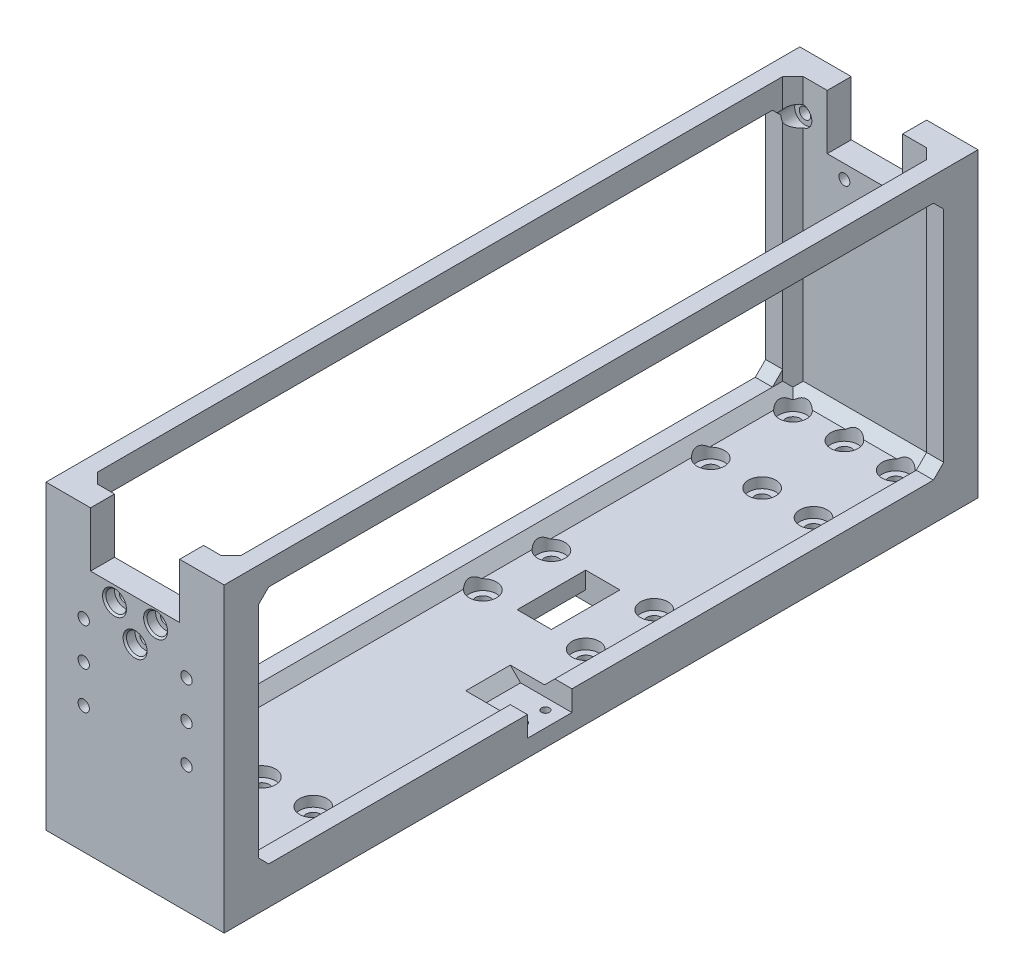
from build123d import *

# Parameters (mm, degrees)
SKETCH1_W            = 52
SKETCH1_H            = 220
BOSS_EXTRUDE1_DEPTH  = 8
SKETCH2_W            = 5
SKETCH2_H            = 220
BOSS_EXTRUDE2_DEPTH  = 80
SKETCH3_W            = 47
SKETCH3_H            = 7
BOSS_EXTRUDE3_DEPTH  = 80
SKETCH4_W            = 47
SKETCH4_H            = 7
BOSS_EXTRUDE4_DEPTH  = 80
SKETCH8_W            = 200
SKETCH8_H            = 80
CUT_EXTRUDE3_DEPTH   = 10
SKETCH12_W           = 5
SKETCH12_H           = 206
SKETCH12_H_2         = 200
BOSS_EXTRUDE6_DEPTH  = 3
SKETCH13_W           = 5
SKETCH13_H           = 3
BOSS_EXTRUDE7_DEPTH  = 77
SKETCH19_W           = 5
SKETCH19_H           = 7
BOSS_EXTRUDE11_DEPTH = 200
SKETCH21_R           = 1.65
CUT_EXTRUDE10_DEPTH  = 10
SKETCH22_R           = 3
CUT_EXTRUDE11_DEPTH  = 2
SKETCH23_R           = 1.65
CUT_EXTRUDE12_DEPTH  = 10
SKETCH24_R           = 3
CUT_EXTRUDE13_DEPTH  = 2
SKETCH25_W           = 26
SKETCH25_H           = 7
CUT_EXTRUDE14_DEPTH  = 16
SKETCH26_W           = 22
SKETCH26_H           = 7
CUT_EXTRUDE15_DEPTH  = 16
SKETCH32_R           = 1.65
CUT_EXTRUDE18_DEPTH  = 10
SKETCH33_R           = 3
CUT_EXTRUDE19_DEPTH  = 4
CHAMFER5_SIZE        = 3
CHAMFER12_SIZE       = 3
CHAMFER16_SIZE       = 3
CHAMFER18_SIZE       = 3
CHAMFER21_SIZE       = 3
SKETCH53_R           = 2.15
CUT_EXTRUDE31_DEPTH  = 11
SKETCH54_R           = 2.15
CUT_EXTRUDE32_DEPTH  = 11
SKETCH55_R           = 4
CUT_EXTRUDE33_DEPTH  = 6
SKETCH56_R           = 2.15
CUT_EXTRUDE34_DEPTH  = 11
SKETCH57_R           = 4
CUT_EXTRUDE35_DEPTH  = 6
SKETCH58_W           = 10
SKETCH58_H           = 20
CUT_EXTRUDE36_DEPTH  = 8
CHAMFER22_SIZE       = 3
SKETCH59_W           = 5
SKETCH59_H           = 3
BOSS_EXTRUDE21_DEPTH = 3
CHAMFER24_SIZE       = 3
SKETCH76_R           = 1.6
CUT_EXTRUDE46_DEPTH  = 7
SKETCH77_R           = 3
CUT_EXTRUDE48_DEPTH  = 3
CHAMFER27_SIZE       = 0.5
CUT_EXTRUDE49_START  = -7
SKETCH78_R           = 1.6
CUT_EXTRUDE49_DEPTH  = 7
CUT_EXTRUDE50_START  = -3
SKETCH79_R           = 3
CUT_EXTRUDE50_DEPTH  = 3
CHAMFER28_SIZE       = 0.5
SKETCH80_W           = 18
SKETCH80_H           = 13
CUT_EXTRUDE51_DEPTH  = 6
CHAMFER29_SIZE       = 3
SKETCH81_R           = 1.15
CUT_EXTRUDE52_DEPTH  = 5


# Some blends are built 0.0001 mm under size
with BuildPart() as part:
    # Sketch1 → Boss-Extrude1 (new body)
    with BuildSketch(Plane(origin=(0, 0, 0), x_dir=(1, 0, 0), z_dir=(0, 1, 0))):
        with Locations((33.761174554, -57.057839406)):
            Rectangle(SKETCH1_W, SKETCH1_H)
    extrude(amount=BOSS_EXTRUDE1_DEPTH)

    # Sketch2 → Boss-Extrude2 (add)
    with BuildSketch(Plane(origin=(0, 8, 0), x_dir=(1, 0, 0), z_dir=(0, 1, 0))):
        with Locations((10.261174554, -57.057839406)):
            Rectangle(SKETCH2_W, SKETCH2_H)
    extrude(amount=BOSS_EXTRUDE2_DEPTH)

    # Sketch3 → Boss-Extrude3 (add)
    with BuildSketch(Plane(origin=(0, 8, 0), x_dir=(1, 0, 0), z_dir=(0, 1, 0))):
        with Locations((36.261174554, -163.557839406)):
            Rectangle(SKETCH3_W, SKETCH3_H)
    extrude(amount=BOSS_EXTRUDE3_DEPTH)

    # Sketch4 → Boss-Extrude4 (add)
    with BuildSketch(Plane(origin=(0, 8, 0), x_dir=(1, 0, 0), z_dir=(0, 1, 0))):
        with Locations((36.261174554, 49.442160594)):
            Rectangle(SKETCH4_W, SKETCH4_H)
    extrude(amount=BOSS_EXTRUDE4_DEPTH)

    # Sketch8 → Cut-Extrude3 (cut)
    with BuildSketch(Plane.ZY.offset(-7.761174554)):
        with Locations((57.057839406, 48)):
            Rectangle(SKETCH8_W, SKETCH8_H)
    extrude(amount=-CUT_EXTRUDE3_DEPTH, mode=Mode.SUBTRACT)

    # Sketch12 → Boss-Extrude6 (add)
    with BuildSketch(Plane(origin=(0, 8, 0), x_dir=(1, 0, 0), z_dir=(0, 1, 0))):
        with Locations((57.261174554, -57.057839406)):
            Rectangle(SKETCH12_W, SKETCH12_H)
        with Locations((10.261174554, -57.057839406)):
            Rectangle(SKETCH12_W, SKETCH12_H_2)
    extrude(amount=BOSS_EXTRUDE6_DEPTH)

    # Sketch13 → Boss-Extrude7 (add)
    with BuildSketch(Plane(origin=(0, 88, 0), x_dir=(1, 0, 0), z_dir=(0, 1, 0))):
        with Locations((57.261174554, -158.557839406)):
            Rectangle(SKETCH13_W, SKETCH13_H)
        with Locations((57.261174554, 44.442160594)):
            Rectangle(SKETCH13_W, SKETCH13_H)
    extrude(amount=-BOSS_EXTRUDE7_DEPTH)

    # Sketch19 → Boss-Extrude11 (add)
    with BuildSketch(Plane.XY.offset(-42.942160594)):
        with Locations((10.261174554, 84.5)):
            Rectangle(SKETCH19_W, SKETCH19_H)
        with Locations((57.261174554, 84.5)):
            Rectangle(SKETCH19_W, SKETCH19_H)
    extrude(amount=BOSS_EXTRUDE11_DEPTH)

    # Sketch21 → Cut-Extrude10 (cut)
    with BuildSketch(Plane.XY.offset(167.057839406)):
        with Locations((18.761174554, 59)):
            Circle(SKETCH21_R)
        with Locations((48.761174554, 59)):
            Circle(SKETCH21_R)
        with Locations((48.761174554, 37)):
            Circle(SKETCH21_R)
        with Locations((18.761174554, 37)):
            Circle(SKETCH21_R)
    extrude(amount=-CUT_EXTRUDE10_DEPTH, mode=Mode.SUBTRACT)

    # Sketch22 → Cut-Extrude11 (cut)
    with BuildSketch(Plane(origin=(0, 0, 160.057839406), x_dir=(-1, 0, 0), z_dir=(0, 0, -1))):
        with Locations((-18.761174554, 59)):
            Circle(SKETCH22_R)
        with Locations((-48.761174554, 59)):
            Circle(SKETCH22_R)
        with Locations((-18.761174554, 37)):
            Circle(SKETCH22_R)
        with Locations((-48.761174554, 37)):
            Circle(SKETCH22_R)
    extrude(amount=-CUT_EXTRUDE11_DEPTH, mode=Mode.SUBTRACT)

    # Sketch23 → Cut-Extrude12 (cut)
    with BuildSketch(Plane.XY.offset(167.057839406)):
        with Locations((18.761174554, 48)):
            Circle(SKETCH23_R)
        with Locations((48.761174554, 48)):
            Circle(SKETCH23_R)
    extrude(amount=-CUT_EXTRUDE12_DEPTH, mode=Mode.SUBTRACT)

    # Sketch24 → Cut-Extrude13 (cut)
    with BuildSketch(Plane(origin=(0, 0, 160.057839406), x_dir=(-1, 0, 0), z_dir=(0, 0, -1))):
        with Locations((-48.761174554, 48)):
            Circle(SKETCH24_R)
        with Locations((-18.761174554, 48)):
            Circle(SKETCH24_R)
    extrude(amount=-CUT_EXTRUDE13_DEPTH, mode=Mode.SUBTRACT)

    # Sketch25 → Cut-Extrude14 (cut)
    with BuildSketch(Plane(origin=(0, 88, 0), x_dir=(1, 0, 0), z_dir=(0, 1, 0))):
        with Locations((33.761174554, -163.557839406)):
            Rectangle(SKETCH25_W, SKETCH25_H)
    extrude(amount=-CUT_EXTRUDE14_DEPTH, mode=Mode.SUBTRACT)

    # Sketch26 → Cut-Extrude15 (cut)
    with BuildSketch(Plane(origin=(0, 88, 0), x_dir=(1, 0, 0), z_dir=(0, 1, 0))):
        with Locations((33.761174554, 49.442160594)):
            Rectangle(SKETCH26_W, SKETCH26_H)
    extrude(amount=-CUT_EXTRUDE15_DEPTH, mode=Mode.SUBTRACT)

    # Sketch32 → Cut-Extrude18 (cut)
    with BuildSketch(Plane(origin=(0, 0, -52.942160594), x_dir=(-1, 0, 0), z_dir=(0, 0, -1))):
        with Locations((-52.261174554, 78)):
            Circle(SKETCH32_R)
        with Locations((-15.261174554, 78)):
            Circle(SKETCH32_R)
    extrude(amount=-CUT_EXTRUDE18_DEPTH, mode=Mode.SUBTRACT)

    # Sketch33 → Cut-Extrude19 (cut)
    with BuildSketch(Plane.XY.offset(-42.942160594)):
        with Locations((15.261174554, 78)):
            Circle(SKETCH33_R)
        with Locations((52.261174554, 78)):
            Circle(SKETCH33_R)
    extrude(amount=-CUT_EXTRUDE19_DEPTH, mode=Mode.SUBTRACT)

    # Chamfer5
    chamfer5_edges = [part.edges().sort_by_distance(p)[0] for p in [
        (57.261174554, 81, -42.942160594),
        (10.261174554, 81, -42.942160594),
        (10.261174554, 81, 157.057839406),
        (57.261174554, 81, 157.057839406),
    ]]
    chamfer(chamfer5_edges, length=CHAMFER5_SIZE)

    # Chamfer12
    chamfer12_edges = [part.edges().sort_by_distance(p)[0] for p in [
        (12.761174554, 83.829156198, -45.942160594),
        (12.761174554, 42.170843802, -45.942160594),
        (54.761174554, 83.829156198, -45.942160594),
        (54.761174554, 42.170843802, -45.942160594),
    ]]
    chamfer(chamfer12_edges, length=CHAMFER12_SIZE - 0.0001)  # a hair under: the kernel refuses the full size

    # Chamfer16
    chamfer16_edges = [part.edges().sort_by_distance(p)[0] for p in [
        (12.761174554, 48, 160.057839406),
        (54.761174554, 48, 160.057839406),
    ]]
    chamfer(chamfer16_edges, length=CHAMFER16_SIZE - 0.0001)  # a hair under: the kernel refuses the full size

    # Chamfer18
    # the kernel refuses this chamfer: 3 mm, written as the material it adds along each edge
    with BuildSketch(Plane(origin=(12.761174554, 8, 164.77298837), x_dir=(-0.027495876610586206, 0.9996219169112968, 0), z_dir=(0, 0, -1)), Plane(origin=(54.761174554, 8, 164.77298837), x_dir=(-0.9996219169112968, -0.02749587661058648, 0), z_dir=(0, 0, -1))) as chamfer18_piece_1:
        Polygon((CHAMFER18_SIZE * 0.999621916911, CHAMFER18_SIZE * 0.0274958766106), (-CHAMFER18_SIZE * 0.0274958766106, CHAMFER18_SIZE * 0.999621916911), (0, 0), align=None)
    extrude(amount=215.430297928)
    with BuildSketch(Plane(origin=(8.046025591, 8, 160.057839406), x_dir=(0, 0.9996219169112969, 0.02749587661058218), z_dir=(1, 0, 0))) as chamfer18_piece_2:
        Polygon((CHAMFER18_SIZE * 0.999621916911, -CHAMFER18_SIZE * 0.0274958766106), (-CHAMFER18_SIZE * 0.0274958766106, -CHAMFER18_SIZE * 0.999621916911), (0, 0), align=None)
    extrude(amount=51.430297928)

    # Chamfer21
    chamfer21_edges = [part.edges().sort_by_distance(p)[0] for p in [
        (33.761174554, 8, -45.942160594),
    ]]
    chamfer(chamfer21_edges, length=CHAMFER21_SIZE)

    # Sketch53 → Cut-Extrude31 (cut)
    with BuildSketch(Plane.XZ):
        with Locations(Location((48.761174554, 154.057839406, 0), (0, 0, 270))):
            Circle(SKETCH53_R)
        with Locations(Location((18.761174554, 154.057839406, 0), (0, 0, 270))):
            Circle(SKETCH53_R)
        with Locations(Location((18.761174554, 130.057839406, 0), (0, 0, 270))):
            Circle(SKETCH53_R)
        with Locations(Location((48.761174554, 130.057839406, 0), (0, 0, 270))):
            Circle(SKETCH53_R)
        with Locations(Location((48.761174554, -15.942160594, 0), (0, 0, 270))):
            Circle(SKETCH53_R)
        with Locations(Location((48.761174554, -39.942160594, 0), (0, 0, 270))):
            Circle(SKETCH53_R)
        with Locations(Location((18.761174554, -15.942160594, 0), (0, 0, 270))):
            Circle(SKETCH53_R)
        with Locations(Location((18.761174554, -39.942160594, 0), (0, 0, 270))):
            Circle(SKETCH53_R)
    extrude(amount=-CUT_EXTRUDE31_DEPTH, mode=Mode.SUBTRACT)

    # Sketch54 → Cut-Extrude32 (cut)
    with BuildSketch(Plane.XZ):
        with Locations(Location((33.761174554, 154.057839406, 0), (0, 0, 270))):
            Circle(SKETCH54_R)
        with Locations(Location((33.761174554, 130.057839406, 0), (0, 0, 270))):
            Circle(SKETCH54_R)
        with Locations(Location((33.761174554, -15.942160594, 0), (0, 0, 270))):
            Circle(SKETCH54_R)
        with Locations(Location((33.761174554, -39.942160594, 0), (0, 0, 270))):
            Circle(SKETCH54_R)
    extrude(amount=-CUT_EXTRUDE32_DEPTH, mode=Mode.SUBTRACT)

    # Sketch55 → Cut-Extrude33 (cut)
    with BuildSketch(Plane(origin=(0, 11, 0), x_dir=(1, 0, 0), z_dir=(0, 1, 0))):
        with Locations(Location((18.761174554, -130.057839406, 0), (0, 0, 270))):
            Circle(SKETCH55_R)
        with Locations(Location((18.761174554, -154.057839406, 0), (0, 0, 270))):
            Circle(SKETCH55_R)
        with Locations(Location((48.761174554, -130.057839406, 0), (0, 0, 270))):
            Circle(SKETCH55_R)
        with Locations(Location((48.761174554, -154.057839406, 0), (0, 0, 270))):
            Circle(SKETCH55_R)
        with Locations(Location((33.761174554, -130.057839406, 0), (0, 0, 270))):
            Circle(SKETCH55_R)
        with Locations(Location((33.761174554, -154.057839406, 0), (0, 0, 270))):
            Circle(SKETCH55_R)
        with Locations(Location((48.761174554, 15.942160594, 0), (0, 0, 270))):
            Circle(SKETCH55_R)
        with Locations(Location((33.761174554, 15.942160594, 0), (0, 0, 270))):
            Circle(SKETCH55_R)
        with Locations(Location((18.761174554, 15.942160594, 0), (0, 0, 270))):
            Circle(SKETCH55_R)
        with Locations(Location((18.761174554, 39.942160594, 0), (0, 0, 270))):
            Circle(SKETCH55_R)
        with Locations(Location((33.761174554, 39.942160594, 0), (0, 0, 270))):
            Circle(SKETCH55_R)
        with Locations(Location((48.761174554, 39.942160594, 0), (0, 0, 270))):
            Circle(SKETCH55_R)
    extrude(amount=-CUT_EXTRUDE33_DEPTH, mode=Mode.SUBTRACT)

    # Sketch56 → Cut-Extrude34 (cut)
    with BuildSketch(Plane.XZ):
        with Locations(Location((18.761174554, 30.557839406, 0), (0, 0, 270))):
            Circle(SKETCH56_R)
        with Locations(Location((18.761174554, 50.557839406, 0), (0, 0, 270))):
            Circle(SKETCH56_R)
        with Locations(Location((48.761174554, 30.557839406, 0), (0, 0, 270))):
            Circle(SKETCH56_R)
        with Locations(Location((48.761174554, 50.557839406, 0), (0, 0, 270))):
            Circle(SKETCH56_R)
    extrude(amount=-CUT_EXTRUDE34_DEPTH, mode=Mode.SUBTRACT)

    # Sketch57 → Cut-Extrude35 (cut)
    with BuildSketch(Plane(origin=(0, 11, 0), x_dir=(1, 0, 0), z_dir=(0, 1, 0))):
        with Locations(Location((48.761174554, -30.557839406, 0), (0, 0, 270))):
            Circle(SKETCH57_R)
        with Locations(Location((48.761174554, -50.557839406, 0), (0, 0, 270))):
            Circle(SKETCH57_R)
        with Locations(Location((18.761174554, -30.557839406, 0), (0, 0, 270))):
            Circle(SKETCH57_R)
        with Locations(Location((18.761174554, -50.557839406, 0), (0, 0, 270))):
            Circle(SKETCH57_R)
    extrude(amount=-CUT_EXTRUDE35_DEPTH, mode=Mode.SUBTRACT)

    # Sketch58 → Cut-Extrude36 (cut)
    with BuildSketch(Plane(origin=(0, 8, 0), x_dir=(1, 0, 0), z_dir=(0, 1, 0))):
        with Locations((33.761174554, -40.557839406)):
            Rectangle(SKETCH58_W, SKETCH58_H)
    extrude(amount=-CUT_EXTRUDE36_DEPTH, mode=Mode.SUBTRACT)

    # Chamfer22
    chamfer22_edges = [part.edges().sort_by_distance(p)[0] for p in [
        (38.761174554, 0, 40.557839406),
        (28.761174554, 0, 40.557839406),
    ]]
    chamfer(chamfer22_edges, length=CHAMFER22_SIZE)

    # Sketch59 → Boss-Extrude21 (add)
    with BuildSketch(Plane(origin=(0, 11, 0), x_dir=(1, 0, 0), z_dir=(0, 1, 0))):
        with Locations((57.261174554, -155.557839406)):
            Rectangle(SKETCH59_W, SKETCH59_H)
        with Locations((10.261174554, -155.557839406)):
            Rectangle(SKETCH59_W, SKETCH59_H)
        with Locations((10.261174554, 41.442160594)):
            Rectangle(SKETCH59_W, SKETCH59_H)
        with Locations((57.261174554, 41.442160594)):
            Rectangle(SKETCH59_W, SKETCH59_H)
    extrude(amount=BOSS_EXTRUDE21_DEPTH)

    # Chamfer24
    chamfer24_edges = [part.edges().sort_by_distance(p)[0] for p in [
        (57.261174554, 14, -39.942160594),
        (10.261174554, 14, -39.942160594),
        (10.261174554, 14, 154.057839406),
        (57.261174554, 14, 154.057839406),
    ]]
    chamfer(chamfer24_edges, length=CHAMFER24_SIZE - 0.0001)  # a hair under: the kernel refuses the full size

    # Sketch76 → Cut-Extrude46 (cut)
    with BuildSketch(Plane(origin=(0, 0, 160.057839406), x_dir=(-1, 0, 0), z_dir=(0, 0, -1))):
        with Locations((-33.761174554, 60)):
            Circle(SKETCH76_R)
        with Locations((-39.761174554, 68)):
            Circle(SKETCH76_R)
        with Locations((-27.752634222, 67.608013981)):
            Circle(SKETCH76_R)
    extrude(amount=-CUT_EXTRUDE46_DEPTH, mode=Mode.SUBTRACT)

    # Sketch77 → Cut-Extrude48 (cut)
    with BuildSketch(Plane.XY.offset(167.057839406)):
        with Locations((39.761174554, 68)):
            Circle(SKETCH77_R)
        with Locations((33.761174554, 60)):
            Circle(SKETCH77_R)
        with Locations((27.752634222, 67.608013981)):
            Circle(SKETCH77_R)
    extrude(amount=-CUT_EXTRUDE48_DEPTH, mode=Mode.SUBTRACT)

    # Chamfer27
    chamfer27_edges = [part.edges().sort_by_distance(p)[0] for p in [
        (24.752634222, 67.608013981, 167.057839406),
        (30.761174554, 60, 167.057839406),
        (36.761174554, 68, 167.057839406),
    ]]
    chamfer(chamfer27_edges, length=CHAMFER27_SIZE)

    # Sketch78 → Cut-Extrude49 (cut)
    with BuildSketch(Plane.XY.offset(-45.942160594).offset(CUT_EXTRUDE49_START)):
        with Locations((27.761174554, 68)):
            Circle(SKETCH78_R)
        with Locations(Location((39.761174554, 68, 0), (0, 0, 180))):
            Circle(SKETCH78_R)
        with Locations(Location((33.761174554, 60, 0), (0, 0, 180))):
            Circle(SKETCH78_R)
    extrude(amount=CUT_EXTRUDE49_DEPTH, mode=Mode.SUBTRACT)

    # Sketch79 → Cut-Extrude50 (cut)
    with BuildSketch(Plane(origin=(0, 0, -52.942160594), x_dir=(-1, 0, 0), z_dir=(0, 0, -1)).offset(CUT_EXTRUDE50_START)):
        with Locations(Location((-39.761174554, 68, 0), (0, 0, 180))):
            Circle(SKETCH79_R)
        with Locations((-27.761174554, 68)):
            Circle(SKETCH79_R)
        with Locations(Location((-33.761174554, 60, 0), (0, 0, 180))):
            Circle(SKETCH79_R)
    extrude(amount=CUT_EXTRUDE50_DEPTH, mode=Mode.SUBTRACT)

    # Chamfer28
    chamfer28_edges = [part.edges().sort_by_distance(p)[0] for p in [
        (30.761174554, 60, -52.942160594),
        (30.761174554, 68, -52.942160594),
        (36.761174554, 68, -52.942160594),
    ]]
    chamfer(chamfer28_edges, length=CHAMFER28_SIZE)

    # Sketch80 → Cut-Extrude51 (cut)
    with BuildSketch(Plane(origin=(0, 11, 0), x_dir=(1, 0, 0), z_dir=(0, 1, 0))):
        with Locations((50.761174554, -72.057839406)):
            Rectangle(SKETCH80_W, SKETCH80_H)
    extrude(amount=-CUT_EXTRUDE51_DEPTH, mode=Mode.SUBTRACT)

    # Chamfer29
    chamfer29_edges = [part.edges().sort_by_distance(p)[0] for p in [
        (41.761174554, 5, 72.057839406),
    ]]
    chamfer(chamfer29_edges, length=CHAMFER29_SIZE - 0.0001)  # a hair under: the kernel refuses the full size

    # Sketch81 → Cut-Extrude52 (cut)
    with BuildSketch(Plane(origin=(0, 5, 0), x_dir=(1, 0, 0), z_dir=(0, 1, 0))):
        with Locations(Location((55.261174554, -75.307839406, 0), (0, 0, 270))):
            Circle(SKETCH81_R)
        with Locations(Location((55.261174554, -68.807839406, 0), (0, 0, 270))):
            Circle(SKETCH81_R)
    extrude(amount=-CUT_EXTRUDE52_DEPTH, mode=Mode.SUBTRACT)


solid = part.part
